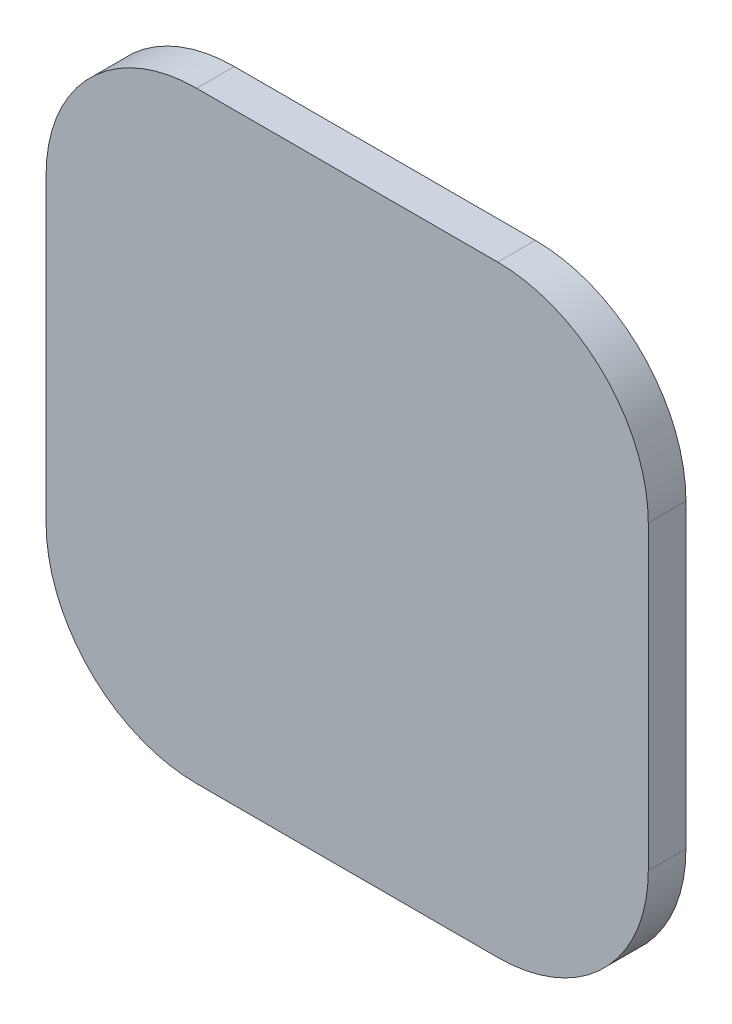
from build123d import *

# Parameters (mm, degrees)
BOSS_EXTRUDE1_DEPTH = 5
SKETCH3_R           = 20
CUT_EXTRUDE2_DEPTH  = 2
SKETCH4_R           = 2.5
BOSS_EXTRUDE2_DEPTH = 7
FILLET1_R           = 10


with BuildPart() as part:
    # Sketch1 → Boss-Extrude1 (new body)
    with BuildSketch(Plane.XY):
        with BuildLine():
            Line((-20, -40), (20, -40))
            ThreePointArc((20, -40), (34.142135624, -34.142135624), (40, -20))
            Line((40, -20), (40, 20))
            ThreePointArc((40, 20), (34.142135624, 34.142135624), (20, 40))
            Line((20, 40), (-20, 40))
            ThreePointArc((-20, 40), (-34.142135624, 34.142135624), (-40, 20))
            Line((-40, 20), (-40, -20))
            ThreePointArc((-40, -20), (-34.142135624, -34.142135624), (-20, -40))
        make_face()
    extrude(amount=BOSS_EXTRUDE1_DEPTH)

    # Sketch3 → Cut-Extrude2 (cut)
    with BuildSketch(Plane(origin=(0, 0, 0), x_dir=(-1, 0, 0), z_dir=(0, 0, -1))):
        Circle(SKETCH3_R)
    extrude(amount=-CUT_EXTRUDE2_DEPTH, mode=Mode.SUBTRACT)

    # Sketch4 → Boss-Extrude2 (add)
    with BuildSketch(Plane(origin=(0, 0, 2), x_dir=(-1, 0, 0), z_dir=(0, 0, -1))):
        Circle(SKETCH4_R)
        with BuildLine():
            Line((-0.997797575, 1.12), (-0.997797575, -1.12))
            ThreePointArc((-0.997797575, -1.12), (1.5, 0), (-0.997797575, 1.12))
        make_face(mode=Mode.SUBTRACT)
    extrude(amount=BOSS_EXTRUDE2_DEPTH)

    # Fillet1
    # the kernel refuses this fillet: 10 mm, written as the material it adds along each edge
    with BuildSketch(Plane(origin=(0, 0, 2), x_dir=(-1, 0, 0), z_dir=(0, -1, 0))) as fillet1_piece_1:
        with BuildLine():
            CenterArc((12.039392014, 10), FILLET1_R, 197.457603124, 72.542396876)
            Line((2.5, 7), (2.30921216, 6.94))
            ThreePointArc((2.30921216, 6.94), (2.3, 3.5), (2.3, 0))
            Line((2.3, 0), (2.5, -0.2))
            Line((2.5, -0.2), (12.039392014, -0.2))
            Line((12.039392014, -0.2), (12.039392014, 0))
        make_face()
    revolve(axis=Axis((0, 0, 2), (0, 0, -1)))


solid = part.part
